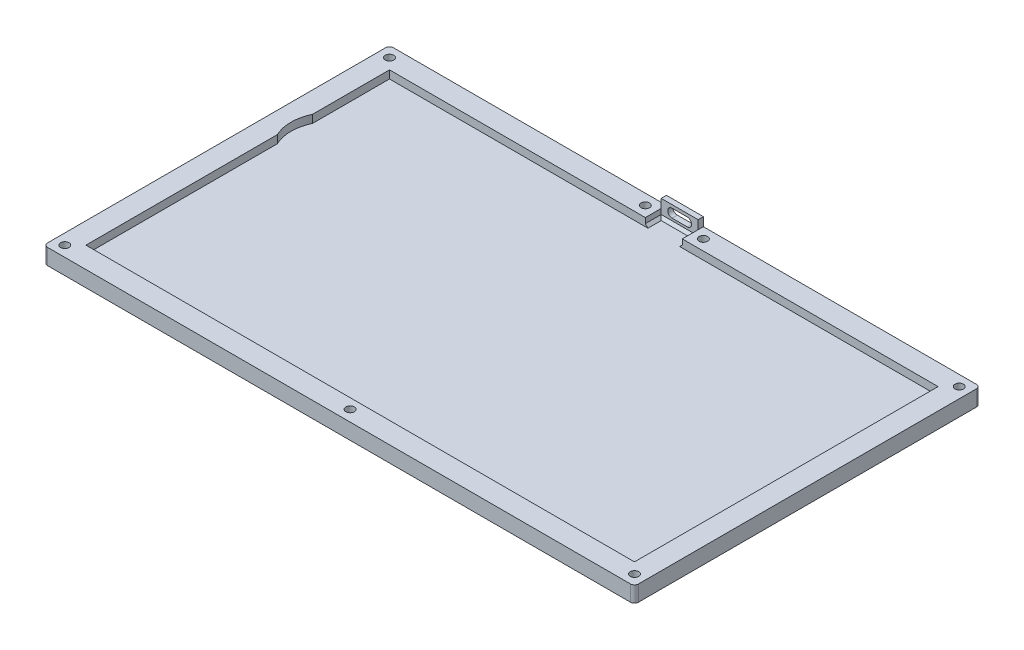
from build123d import *

# Parameters (mm, degrees)
SKETCH1_W                     = 223.798385105
SKETCH1_H                     = 130.999439423
BOSS_EXTRUDE1_DEPTH           = 3
SKETCH2_W                     = 223.798385105
SKETCH2_H                     = 130.999439423
SKETCH2_W_2                   = 207.798385105
SKETCH2_H_2                   = 114.999439423
BOSS_EXTRUDE2_DEPTH           = 3
SKETCH3_W                     = 14
SKETCH3_H                     = 8
BOSS_EXTRUDE3_DEPTH           = 3.3
CUT_EXTRUDE1_REACH            = 278.878
SKETCH7_R                     = 15.5
CSK_FOR_M3_SFHCS1_D           = 3.2
CSK_FOR_M3_SFHCS1_CSINK_D     = 6.72
CSK_FOR_M3_SFHCS1_CSINK_ANGLE = 90
FILLET1_R                     = 1.5
CUT_EXTRUDE2_REACH            = 267.036
SKETCH10_W                    = 14
SKETCH10_H                    = 6.3
CUT_EXTRUDE3_DEPTH            = 6
CHAMFER1_SIZE                 = 1


with BuildPart() as part:
    # Sketch1 → Boss-Extrude1 (new body)
    with BuildSketch(Plane(origin=(0, 0, 0), x_dir=(1, 0, 0), z_dir=(0, 1, 0))):
        with Locations((118.310511765, 88.205666229)):
            Rectangle(SKETCH1_W, SKETCH1_H)
    extrude(amount=BOSS_EXTRUDE1_DEPTH)

    # Sketch2 → Boss-Extrude2 (add)
    with BuildSketch(Plane(origin=(0, 3, 0), x_dir=(1, 0, 0), z_dir=(0, 1, 0))):
        with Locations((118.310511765, 88.205666229)):
            Rectangle(SKETCH2_W, SKETCH2_H)
        with Locations((118.310511765, 88.205666229)):
            Rectangle(SKETCH2_W_2, SKETCH2_H_2, mode=Mode.SUBTRACT)
    extrude(amount=BOSS_EXTRUDE2_DEPTH)

    # Sketch3 → Boss-Extrude3 (add)
    with BuildSketch(Plane(origin=(0, 6, 0), x_dir=(1, 0, 0), z_dir=(0, 1, 0))):
        with Locations((118.310511764, 149.70538594)):
            Rectangle(SKETCH3_W, SKETCH3_H)
    extrude(amount=BOSS_EXTRUDE3_DEPTH)

    # Sketch7 → Cut-Extrude1 (cut, up to next)
    with BuildSketch(Plane(origin=(0, 3, 0), x_dir=(1, 0, 0), z_dir=(0, 1, 0)), mode=Mode.PRIVATE) as cut_extrude1_sk1:
        with Locations((28.411319212, 109.89748089)):
            Circle(SKETCH7_R)
    cut_extrude1_tool1 = extrude(cut_extrude1_sk1.sketch, amount=CUT_EXTRUDE1_REACH, mode=Mode.PRIVATE) & part.part
    add(cut_extrude1_tool1.solids().sort_by_distance((28.411319, 3, -109.897481))[0], mode=Mode.SUBTRACT)

    # CSK for M3 SFHCS1 (through all)
    with Locations(Plane(origin=(0, 0, 0), x_dir=(-1, 0, 0), z_dir=(0, -1, 0))):
        with Locations((-10.411319212, 26.705946517), (-226.209704317, 26.705946517), (-226.209704317, 149.70538594), (-10.411319212, 149.70538594), (-118.310511764, 26.878901274), (-129.310511764, 149.70538594), (-107.310511764, 149.70538594)):
            CounterSinkHole(CSK_FOR_M3_SFHCS1_D / 2, CSK_FOR_M3_SFHCS1_CSINK_D / 2, counter_sink_angle=CSK_FOR_M3_SFHCS1_CSINK_ANGLE)

    # Fillet1
    fillet1_edges = [part.edges().sort_by_distance(p)[0] for p in [
        (6.411319212, 3, -153.70538594),
        (6.411319212, 3, -22.705946517),
        (230.209704317, 3, -153.70538594),
        (230.209704317, 3, -22.705946517),
    ]]
    fillet(fillet1_edges, radius=FILLET1_R)

    # Sketch9 → Cut-Extrude2 (cut, up to next)
    with BuildSketch(Plane(origin=(0, 0, -153.70538594), x_dir=(-1, 0, 0), z_dir=(0, 0, -1)), mode=Mode.PRIVATE) as cut_extrude2_sk1:
        with BuildLine():
            Line((-121.185511764, 8.123368098), (-115.435511764, 8.123368098))
            ThreePointArc((-115.435511764, 8.123368098), (-113.810511764, 6.498368098), (-115.435511764, 4.873368098))
            Line((-115.435511764, 4.873368098), (-121.185511764, 4.873368098))
            ThreePointArc((-121.185511764, 4.873368098), (-122.810511764, 6.498368098), (-121.185511764, 8.123368098))
        make_face()
    cut_extrude2_tool1 = extrude(cut_extrude2_sk1.sketch, amount=-CUT_EXTRUDE2_REACH, mode=Mode.PRIVATE) & part.part
    add(cut_extrude2_tool1.solids().sort_by_distance((118.310512, 6.498368, -153.705386))[0], mode=Mode.SUBTRACT)

    # Sketch10 → Cut-Extrude3 (cut)
    with BuildSketch(Plane.XY.offset(-145.70538594)):
        with Locations((118.310511764, 6.15)):
            Rectangle(SKETCH10_W, SKETCH10_H)
    extrude(amount=-CUT_EXTRUDE3_DEPTH, mode=Mode.SUBTRACT)

    # Chamfer1
    chamfer1_edges = [part.edges().sort_by_distance(p)[0] for p in [
        (125.310511764, 3, -148.70538594),
        (118.310511764, 3, -151.70538594),
        (111.310511764, 3, -148.70538594),
    ]]
    chamfer(chamfer1_edges, length=CHAMFER1_SIZE)


solid = part.part
